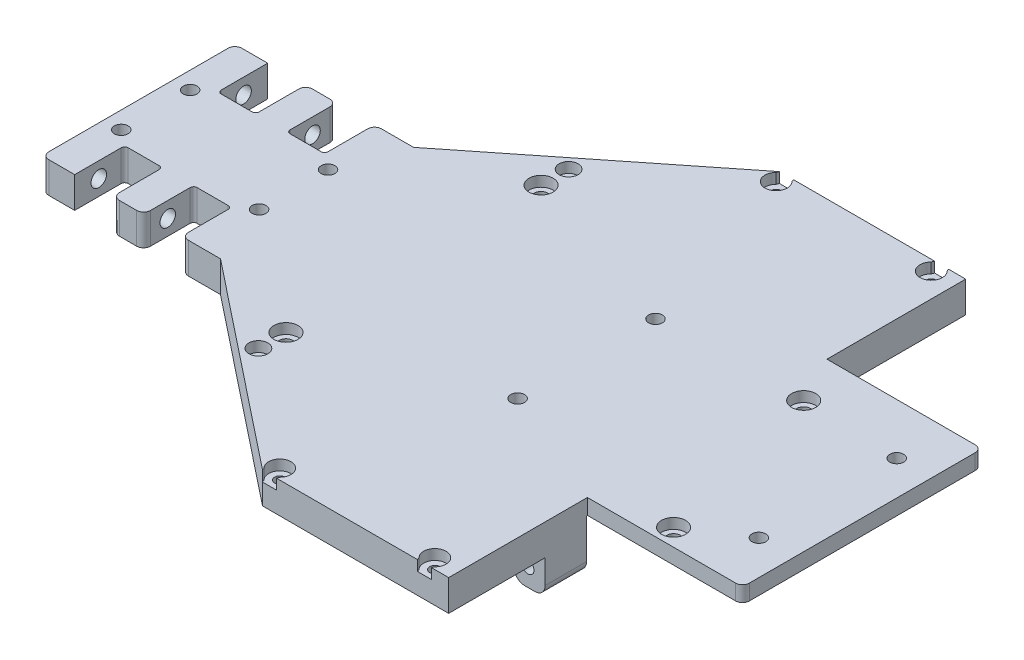
from build123d import *

# Parameters (mm, degrees)
BOSS_EXTRUDE1_DEPTH = 9
SKETCH3_R           = 2
CUT_EXTRUDE1_DEPTH  = 116.215256417
SKETCH4_W           = 69.5
SKETCH4_H           = 4.5
BOSS_EXTRUDE2_DEPTH = 45
SKETCH5_W           = 70
SKETCH5_H           = 4.5
CUT_EXTRUDE2_DEPTH  = 50
SKETCH6_R           = 2
CUT_EXTRUDE4_DEPTH  = 50
FILLET1_R           = 2
FILLET2_R           = 2
SKETCH7_W           = 11
SKETCH7_H           = 11.5
CUT_EXTRUDE5_DEPTH  = 153.08328408
SKETCH8_R           = 2.25
CUT_EXTRUDE6_DEPTH  = 50
SKETCH10_R          = 3.5
CUT_EXTRUDE8_DEPTH  = 4
CUT_EXTRUDE9_START  = -3
CUT_EXTRUDE9_DEPTH  = 5
FILLET6_R           = 1
SKETCH12_R          = 1.5
CUT_EXTRUDE10_DEPTH = 10
SKETCH13_R          = 3.25
CUT_EXTRUDE11_DEPTH = 3
CHAMFER1_SIZE       = 0.764705882
SKETCH14_W          = 12
SKETCH14_H          = 9
BOSS_EXTRUDE3_DEPTH = 3
SKETCH15_R          = 2
CUT_EXTRUDE12_DEPTH = 152.883426668
SKETCH16_R          = 2
SKETCH16_R_2        = 1.5
CUT_EXTRUDE13_DEPTH = 10
SKETCH17_W          = 9
SKETCH17_H          = 12
BOSS_EXTRUDE4_DEPTH = 10
SKETCH18_R          = 1.75
CUT_EXTRUDE14_DEPTH = 181.020346896
FILLET8_R           = 3
CHAMFER2_SIZE       = 0.5
SKETCH19_R          = 2.75
SKETCH19_R_2        = 3.5
CUT_EXTRUDE15_DEPTH = 3
SKETCH20_W          = 9
SKETCH20_H          = 9
SKETCH20_W_2        = 9.5
BOSS_EXTRUDE5_DEPTH = 3
FILLET9_R           = 2
CUT_EXTRUDE16_DEPTH = 10


with BuildPart() as part:
    # Sketch1 → Boss-Extrude1 (new body)
    with BuildSketch(Plane(origin=(0, 0, 0), x_dir=(1, 0, 0), z_dir=(0, 1, 0))):
        Polygon((-78.00255572, 25), (-28.00255572, 25), (1.99744428, 75), (86.99744428, 75), (86.99744428, -75), (1.99744428, -75), (-28.00255572, -25), (-78.00255572, -25), align=None)
    extrude(amount=BOSS_EXTRUDE1_DEPTH)

    # Sketch3 → Cut-Extrude1 (cut, through all)
    with BuildSketch(Plane(origin=(0, 9, 0), x_dir=(1, 0, 0), z_dir=(0, 1, 0))):
        with Locations(Location((-73.00255572, 10, 0), (0, 0, 270))):
            Circle(SKETCH3_R)
        with Locations(Location((-33.00255572, 10, 0), (0, 0, 270))):
            Circle(SKETCH3_R)
        with Locations(Location((-33.00255572, -10, 0), (0, 0, 270))):
            Circle(SKETCH3_R)
        with Locations(Location((-73.00255572, -10, 0), (0, 0, 270))):
            Circle(SKETCH3_R)
    extrude(amount=-CUT_EXTRUDE1_DEPTH, mode=Mode.SUBTRACT)

    # Sketch4 → Boss-Extrude2 (add)
    with BuildSketch(Plane(origin=(86.99744428, 0, 0), x_dir=(0, 0, -1), z_dir=(1, 0, 0))):
        with Locations((0, 6.75)):
            Rectangle(SKETCH4_W, SKETCH4_H)
    extrude(amount=BOSS_EXTRUDE2_DEPTH)

    # Sketch5 → Cut-Extrude2 (cut)
    with BuildSketch(Plane(origin=(86.99744428, 0, 0), x_dir=(0, 0, -1), z_dir=(1, 0, 0))):
        with Locations((0, 2.25)):
            Rectangle(SKETCH5_W, SKETCH5_H)
    extrude(amount=-CUT_EXTRUDE2_DEPTH, mode=Mode.SUBTRACT)

    # Sketch6 → Cut-Extrude4 (cut)
    with BuildSketch(Plane(origin=(0, 9, 0), x_dir=(1, 0, 0), z_dir=(0, 1, 0))):
        with Locations(Location((51.99744428, 20, 0), (0, 0, 270))):
            Circle(SKETCH6_R)
        with Locations(Location((51.99744428, -20, 0), (0, 0, 270))):
            Circle(SKETCH6_R)
        with Locations(Location((121.99744428, 20, 0), (0, 0, 270))):
            Circle(SKETCH6_R)
        with Locations(Location((121.99744428, -20, 0), (0, 0, 270))):
            Circle(SKETCH6_R)
    extrude(amount=-CUT_EXTRUDE4_DEPTH, mode=Mode.SUBTRACT)

    # Fillet1
    fillet1_edges = [part.edges().sort_by_distance(p)[0] for p in [
        (-28.00255572, 4.5, 25),
        (-28.00255572, 4.5, -25),
    ]]
    fillet(fillet1_edges, radius=FILLET1_R)

    # Fillet2
    fillet2_edges = [part.edges().sort_by_distance(p)[0] for p in [
        (131.99744428, 6.75, 34.75),
        (131.99744428, 6.75, -34.75),
    ]]
    fillet(fillet2_edges, radius=FILLET2_R)

    # Sketch7 → Cut-Extrude5 (cut, through all)
    with BuildSketch(Plane(origin=(0, 9, 0), x_dir=(1, 0, 0), z_dir=(0, 1, 0))):
        with Locations((-63.00255572, -19.25)):
            Rectangle(SKETCH7_W, SKETCH7_H)
        with Locations((-43.00255572, -19.25)):
            Rectangle(SKETCH7_W, SKETCH7_H)
    cut_extrude5 = extrude(amount=-CUT_EXTRUDE5_DEPTH, mode=Mode.SUBTRACT)

    # Sketch8 → Cut-Extrude6 (cut)
    with BuildSketch(Plane.ZY.offset(78.00255572)):
        with Locations((21, 4.5)):
            Circle(SKETCH8_R)
    cut_extrude6 = extrude(amount=-CUT_EXTRUDE6_DEPTH, mode=Mode.SUBTRACT)

    # Sketch10 → Cut-Extrude8 (cut)
    with BuildSketch(Plane.ZY.offset(78.00255572)):
        with Locations((21, 4.5)):
            Circle(SKETCH10_R)
    cut_extrude8 = extrude(amount=-CUT_EXTRUDE8_DEPTH, mode=Mode.SUBTRACT)

    # Sketch11 → Cut-Extrude9 (cut)
    with BuildSketch(Plane.ZY.offset(37.50255572).offset(CUT_EXTRUDE9_START)):
        Polygon((17.016283143, 4.5), (17.016283143, -4.719741523), (24.983716857, -4.719741523), (24.983716857, 4.5), (22.991858429, 7.95), (19.008141571, 7.95), align=None)
    cut_extrude9 = extrude(amount=-CUT_EXTRUDE9_DEPTH, mode=Mode.SUBTRACT)

    # Mirror8: Cut-Extrude5, Cut-Extrude6, Cut-Extrude8, Cut-Extrude9 across plane
    add(cut_extrude5.mirror(Plane.XY), mode=Mode.SUBTRACT)
    add(cut_extrude6.mirror(Plane.XY), mode=Mode.SUBTRACT)
    add(cut_extrude8.mirror(Plane.XY), mode=Mode.SUBTRACT)
    add(cut_extrude9.mirror(Plane.XY), mode=Mode.SUBTRACT)

    # Fillet6
    fillet6_edges = [part.edges().sort_by_distance(p)[0] for p in [
        (-68.50255572, 4.5, 13.5),
        (-57.50255572, 4.5, 13.5),
        (-48.50255572, 4.5, 13.5),
        (-37.50255572, 4.5, 13.5),
        (-68.50255572, 4.5, -13.5),
        (-57.50255572, 4.5, -13.5),
        (-48.50255572, 4.5, -13.5),
        (-37.50255572, 4.5, -13.5),
    ]]
    fillet(fillet6_edges, radius=FILLET6_R)

    # Sketch12 → Cut-Extrude10 (cut)
    with BuildSketch(Plane.XZ):
        with Locations(Location((34.99744428, 72, 0), (0, 0, 270))):
            Circle(SKETCH12_R)
        with Locations(Location((79.99744428, 72, 0), (0, 0, 270))):
            Circle(SKETCH12_R)
        with Locations(Location((79.99744428, -72, 0), (0, 0, 90))):
            Circle(SKETCH12_R)
        with Locations(Location((34.99744428, -72, 0), (0, 0, 90))):
            Circle(SKETCH12_R)
    extrude(amount=-CUT_EXTRUDE10_DEPTH, mode=Mode.SUBTRACT)

    # Sketch13 → Cut-Extrude11 (cut)
    with BuildSketch(Plane(origin=(0, 9, 0), x_dir=(1, 0, 0), z_dir=(0, 1, 0))):
        with Locations((34.99744428, 72)):
            Circle(SKETCH13_R)
        with Locations((79.99744428, 72)):
            Circle(SKETCH13_R)
        with Locations((79.99744428, -72)):
            Circle(SKETCH13_R)
        with Locations((34.99744428, -72)):
            Circle(SKETCH13_R)
    extrude(amount=-CUT_EXTRUDE11_DEPTH, mode=Mode.SUBTRACT)

    # Chamfer1
    # the kernel refuses this chamfer: 1, 0.764705882 mm, written as the material it takes off along each edge
    with BuildSketch(Plane(origin=(81.24744428, 6, 75), x_dir=(0.8297221102000071, 0, -0.5581766923163732), z_dir=(0, 1, 0)), Plane(origin=(36.24744428, 6, 75), x_dir=(0.8297221102000105, 0, -0.5581766923163681), z_dir=(0, 1, 0)), Plane(origin=(33.74744428, 6, -75), x_dir=(-0.8297221102000019, 0, 0.5581766923163809), z_dir=(0, 1, 0)), Plane(origin=(78.74744428, 6, -75), x_dir=(-0.8297221102000036, 0, 0.5581766923163785), z_dir=(0, 1, 0))) as chamfer1_piece_1:
        with BuildLine():
            Line((1.274754878, 0), (CHAMFER1_SIZE * 0.829722110583, -CHAMFER1_SIZE * 0.558176692574))
            Line((CHAMFER1_SIZE * 0.829722110583, -CHAMFER1_SIZE * 0.558176692574), (0, 0))
            ThreePointArc((0, 0), (0.654407051, -0.063068187), (1.274754878, 0))
        make_face()
    extrude(amount=6.270562656, mode=Mode.SUBTRACT)
    with BuildSketch(Plane(origin=(78.74744428, 6, 75), x_dir=(-0.8297221102000071, 0, -0.5581766923163732), z_dir=(0, 1, 0)), Plane(origin=(33.74744428, 6, 75), x_dir=(-0.8297221102000089, 0, -0.5581766923163708), z_dir=(0, 1, 0)), Plane(origin=(36.24744428, 6, -75), x_dir=(0.8297221102000036, 0, 0.5581766923163785), z_dir=(0, 1, 0)), Plane(origin=(81.24744428, 6, -75), x_dir=(0.8297221101999984, 0, 0.5581766923163861), z_dir=(0, 1, 0))) as chamfer1_piece_2:
        with BuildLine():
            Line((1.274754878, 0), (CHAMFER1_SIZE * 0.829722110583, CHAMFER1_SIZE * 0.558176692574))
            Line((CHAMFER1_SIZE * 0.829722110583, CHAMFER1_SIZE * 0.558176692574), (0, 0))
            ThreePointArc((0, 0), (0.654407051, 0.063068187), (1.274754878, 0))
        make_face()
    extrude(amount=6.270562656, mode=Mode.SUBTRACT)

    # Sketch14 → Boss-Extrude3 (add)
    with BuildSketch(Plane.XY.offset(25)):
        with Locations((-31.50255572, 4.5)):
            Rectangle(SKETCH14_W, SKETCH14_H)
    boss_extrude3 = extrude(amount=BOSS_EXTRUDE3_DEPTH)

    # Mirror10: Boss-Extrude3 across plane
    add(boss_extrude3.mirror(Plane.XY))

    # Sketch15 → Cut-Extrude12 (cut, through all)
    with BuildSketch(Plane.XZ.offset(-4.5)):
        with Locations(Location((93.99744428, -21, 0), (0, 0, 270))):
            Circle(SKETCH15_R)
        with Locations(Location((106.99744428, 29.75, 0), (0, 0, 270))):
            Circle(SKETCH15_R)
    extrude(amount=-CUT_EXTRUDE12_DEPTH, mode=Mode.SUBTRACT)

    # Sketch16 → Cut-Extrude13 (cut)
    with BuildSketch(Plane.XZ):
        with Locations(Location((1.79744428, -37, 0), (0, 0, 270))):
            Circle(SKETCH16_R)
        with Locations(Location((1.79744428, -45, 0), (0, 0, 270))):
            Circle(SKETCH16_R_2)
        with Locations(Location((1.79744428, 45, 0), (0, 0, 90))):
            Circle(SKETCH16_R_2)
        with Locations(Location((1.79744428, 37, 0), (0, 0, 90))):
            Circle(SKETCH16_R)
    extrude(amount=-CUT_EXTRUDE13_DEPTH, mode=Mode.SUBTRACT)

    # Sketch17 → Boss-Extrude4 (add)
    with BuildSketch(Plane.XZ):
        with Locations((32.49744428, 41)):
            Rectangle(SKETCH17_W, SKETCH17_H)
        with Locations((82.49744428, 41)):
            Rectangle(SKETCH17_W, SKETCH17_H)
    extrude(amount=BOSS_EXTRUDE4_DEPTH)

    # Sketch18 → Cut-Extrude14 (cut, through all)
    with BuildSketch(Plane.XY.offset(47)):
        with Locations((32.99744428, -4.816681728)):
            Circle(SKETCH18_R)
        with Locations((81.99744428, -4.816681728)):
            Circle(SKETCH18_R)
    extrude(amount=-CUT_EXTRUDE14_DEPTH, mode=Mode.SUBTRACT)

    # Fillet8
    # the kernel refuses this fillet: 3 mm, written as the material it adds along each edge
    with BuildSketch(Plane(origin=(27.99744428, 0, 35), x_dir=(-1, 0, 0), z_dir=(0, 0, 1))) as fillet8_piece_1:
        with BuildLine():
            CenterArc((FILLET8_R, FILLET8_R), FILLET8_R, 180, 90)
            Line((0, FILLET8_R), (0, 0))
            Line((0, 0), (FILLET8_R, 0))
        make_face()
    extrude(amount=12)
    with BuildSketch(Plane(origin=(36.99744428, 0, 35), x_dir=(0, 0, -1), z_dir=(-1, 0, 0))) as fillet8_piece_2:
        with BuildLine():
            CenterArc((FILLET8_R, FILLET8_R), FILLET8_R, 180, 90)
            Line((0, FILLET8_R), (0, 0))
            Line((0, 0), (FILLET8_R, 0))
        make_face()
    extrude(amount=9)
    with BuildSketch(Plane(origin=(27.99744428, 0, 27.5), x_dir=(-1, 0, 0), z_dir=(0, 0, 1))) as fillet8_piece_3a_section:
        with BuildLine():
            CenterArc((FILLET8_R, FILLET8_R), FILLET8_R, 180, 90)
            Line((0, FILLET8_R), (0, 0))
            Line((0, 0), (FILLET8_R, 0))
        make_face()
    fillet8_piece_3a = extrude(amount=19.5, mode=Mode.PRIVATE)
    fillet8_piece_3a = split(fillet8_piece_3a, bisect_by=Plane(origin=(27.99744428, 0, 35), z_dir=(0, 0, -1)), keep=Keep.TOP, mode=Mode.PRIVATE)
    with BuildSketch(Plane(origin=(36.99744428, 0, 35), x_dir=(0, 0, -1), z_dir=(-1, 0, 0))) as fillet8_piece_3b_section:
        with BuildLine():
            CenterArc((FILLET8_R, FILLET8_R), FILLET8_R, 180, 90)
            Line((0, FILLET8_R), (0, 0))
            Line((0, 0), (FILLET8_R, 0))
        make_face()
    fillet8_piece_3b = extrude(amount=16.5, mode=Mode.PRIVATE)
    fillet8_piece_3b = split(fillet8_piece_3b, bisect_by=Plane(origin=(27.99744428, 0, 35), z_dir=(-1, 0, 0)), keep=Keep.TOP, mode=Mode.PRIVATE)
    fillet8_piece_3 = fillet8_piece_3a & fillet8_piece_3b
    add(fillet8_piece_3)
    # the kernel refuses this fillet: 3 mm, written as the material it takes off along each edge
    with BuildSketch(Plane(origin=(27.99744428, -10, 27.5), x_dir=(1, 0, 0), z_dir=(0, 0, 1)), Plane(origin=(36.99744428, -10, 54.5), x_dir=(-1, 0, 0), z_dir=(0, 0, -1)), Plane(origin=(77.99744428, -10, 27.5), x_dir=(1, 0, 0), z_dir=(0, 0, 1)), Plane(origin=(86.99744428, -10, 54.5), x_dir=(-1, 0, 0), z_dir=(0, 0, -1))) as fillet8_2_piece_1:
        with BuildLine():
            CenterArc((FILLET8_R, FILLET8_R), FILLET8_R, 180, 90)
            Line((0, FILLET8_R), (0, 0))
            Line((0, 0), (FILLET8_R, 0))
        make_face()
    extrude(amount=27, mode=Mode.SUBTRACT)

    # Chamfer2
    chamfer2_edges = [part.edges().sort_by_distance(p)[0] for p in [
        (-73.00255572, 0, 8),
        (-33.00255572, 0, 8),
        (34.99744428, 0, -73.5),
        (79.99744428, 0, -73.5),
        (79.99744428, 0, 73.5),
        (-33.00255572, 0, -12),
        (34.99744428, 0, 73.5),
        (-73.00255572, 0, -12),
        (1.79744428, 0, 43.5),
        (1.79744428, 0, -43.5),
        (1.79744428, 0, 35),
        (1.79744428, 0, -35),
    ]]
    chamfer(chamfer2_edges, length=CHAMFER2_SIZE)

    # Sketch19 → Cut-Extrude15 (cut)
    with BuildSketch(Plane(origin=(0, 9, 0), x_dir=(1, 0, 0), z_dir=(0, 1, 0))):
        with Locations(Location((1.79744428, 45, 0), (0, 0, 270))):
            Circle(SKETCH19_R)
        with Locations(Location((1.79744428, -45, 0), (0, 0, 270))):
            Circle(SKETCH19_R)
        with Locations(Location((1.79744428, -37, 0), (0, 0, 270))):
            Circle(SKETCH19_R_2)
        with Locations(Location((106.99744428, -29.75, 0), (0, 0, 270))):
            Circle(SKETCH19_R_2)
        with Locations(Location((1.79744428, 37, 0), (0, 0, 270))):
            Circle(SKETCH19_R_2)
        with Locations(Location((93.99744428, 21, 0), (0, 0, 270))):
            Circle(SKETCH19_R_2)
    extrude(amount=-CUT_EXTRUDE15_DEPTH, mode=Mode.SUBTRACT)

    # Sketch20 → Boss-Extrude5 (add)
    with BuildSketch(Plane(origin=(0, 0, -25), x_dir=(-1, 0, 0), z_dir=(0, 0, -1))):
        with Locations((53.00255572, 4.5)):
            Rectangle(SKETCH20_W, SKETCH20_H)
        with Locations((73.25255572, 4.5)):
            Rectangle(SKETCH20_W_2, SKETCH20_H)
    boss_extrude5 = extrude(amount=BOSS_EXTRUDE5_DEPTH)

    # Mirror11: Boss-Extrude5 across plane
    add(boss_extrude5.mirror(Plane.XY))

    # Fillet9
    fillet9_edges = [part.edges().sort_by_distance(p)[0] for p in [
        (-37.50255572, 4.5, 28),
        (-37.50255572, 4.5, -28),
        (-57.50255572, 4.5, -28),
        (-48.50255572, 4.5, -28),
        (-78.00255572, 4.5, -28),
        (-57.50255572, 4.5, 28),
        (-48.50255572, 4.5, 28),
        (-78.00255572, 4.5, 28),
    ]]
    fillet(fillet9_edges, radius=FILLET9_R)

    # Sketch21 → Cut-Extrude16 (cut)
    with BuildSketch(Plane.XZ):
        Polygon((-26.20255572, 28), (32.99744428, 75), (1.99744428, 75), align=None)
        Polygon((32.99744428, -75), (-26.20255572, -28), (1.99744428, -75), align=None)
    extrude(amount=-CUT_EXTRUDE16_DEPTH, mode=Mode.SUBTRACT)


solid = part.part
